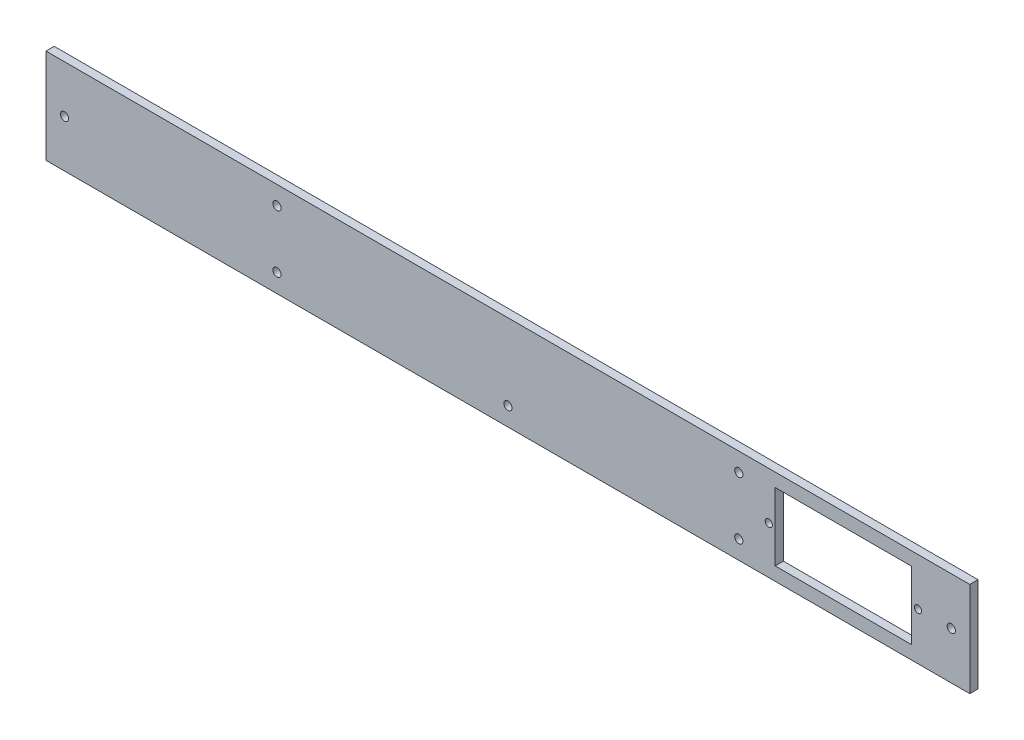
from build123d import *

# Parameters (mm, degrees)
SCHIZZO1_W                   = 449
SCHIZZO1_H                   = 46
SCHIZZO1_R                   = 2
SCHIZZO1_R_2                 = 1.75
SCHIZZO1_W_2                 = 66.3
SCHIZZO1_H_2                 = 33
ESTRUSIONE_ESTRUSIONE1_DEPTH = 4


with BuildPart() as part:
    # Schizzo1 → Estrusione-Estrusione1 (new body)
    with BuildSketch(Plane.XY):
        with Locations((224.5, 23)):
            Rectangle(SCHIZZO1_W, SCHIZZO1_H)
        with Locations((9, 23)):
            Circle(SCHIZZO1_R, mode=Mode.SUBTRACT)
        with Locations((112.25, 37)):
            Circle(SCHIZZO1_R, mode=Mode.SUBTRACT)
        with Locations((224.5, 9)):
            Circle(SCHIZZO1_R, mode=Mode.SUBTRACT)
        with Locations((440, 23)):
            Circle(SCHIZZO1_R, mode=Mode.SUBTRACT)
        with Locations((336.75, 37)):
            Circle(SCHIZZO1_R, mode=Mode.SUBTRACT)
        with Locations((423.813913117, 23)):
            Circle(SCHIZZO1_R_2, mode=Mode.SUBTRACT)
        with Locations((351.313913117, 23)):
            Circle(SCHIZZO1_R_2, mode=Mode.SUBTRACT)
        with Locations((336.75, 9)):
            Circle(SCHIZZO1_R, mode=Mode.SUBTRACT)
        with Locations((112.25, 9)):
            Circle(SCHIZZO1_R, mode=Mode.SUBTRACT)
        with Locations((387.563913117, 23)):
            Rectangle(SCHIZZO1_W_2, SCHIZZO1_H_2, mode=Mode.SUBTRACT)
    extrude(amount=ESTRUSIONE_ESTRUSIONE1_DEPTH)


solid = part.part
